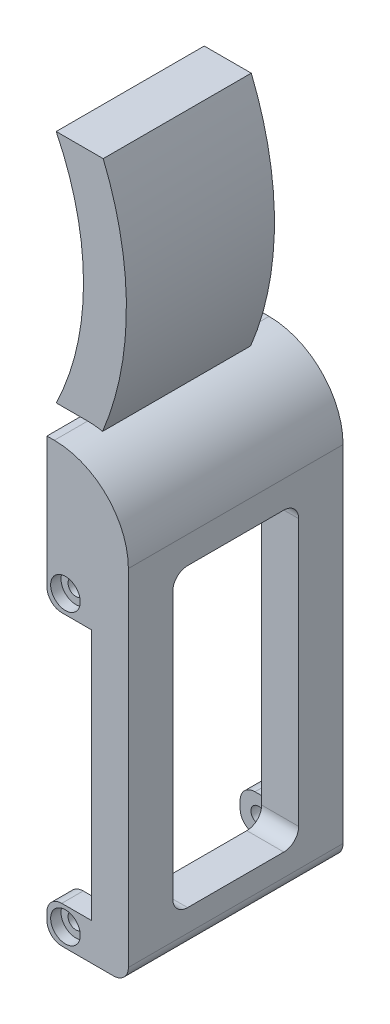
from build123d import *

# Parameters (mm, degrees)
BOSS_EXTRUDE5_DEPTH = 10
BOSS_EXTRUDE6_DEPTH = 14.5
BOSS_EXTRUDE7_REACH = 63.425
SKETCH28_W          = 11
SKETCH28_H          = 29
SKETCH37_W          = 23.2
SKETCH37_H          = 14.666666667
CUT_EXTRUDE10_DEPTH = 6
SKETCH38_W          = 23.2
SKETCH38_H          = 5
CUT_EXTRUDE11_DEPTH = 6
SKETCH39_R          = 1.05
CUT_EXTRUDE12_DEPTH = 81.736980805
SKETCH40_R          = 2
CUT_EXTRUDE13_DEPTH = 1.4
SKETCH41_R          = 2
CUT_EXTRUDE14_DEPTH = 1.4
SKETCH42_W          = 17
SKETCH42_H          = 40
CUT_EXTRUDE15_DEPTH = 77.175521458
FILLET2_R           = 2
CUT_EXTRUDE16_DEPTH = 80.232001549
BOSS_EXTRUDE8_DEPTH = 10
FILLET3_R           = 10


with BuildPart() as part:
    # Sketch25 → Boss-Extrude5 (new, symmetric)
    with BuildSketch(Plane.XY):
        with BuildLine():
            Line((0, 15.875), (6.35, 15.875))
            ThreePointArc((6.35, 15.875), (9.840958299, 0), (6.35, -15.875))
            Line((6.35, -15.875), (0, -15.875))
            ThreePointArc((0, -15.875), (4.187196601, 0), (0, 15.875))
        make_face()
    extrude(amount=BOSS_EXTRUDE5_DEPTH, both=True)


with BuildPart() as body_2:
    # Sketch27 → Boss-Extrude6 (new, symmetric)
    with BuildSketch(Plane.XY):
        Polygon((0, -30.541666667), (11, -30.541666667), (11, -74.541666667), (0, -74.541666667), (0, -69.541666667), (6, -69.541666667), (6, -35.541666667), (0, -35.541666667), align=None)
    extrude(amount=BOSS_EXTRUDE6_DEPTH, both=True)

    # Sketch28 → Boss-Extrude7 (add, up to next)
    with BuildSketch(Plane.XZ.offset(15.875), mode=Mode.PRIVATE) as boss_extrude7_sk1:
        with Locations((5.5, 0)):
            Rectangle(SKETCH28_W, SKETCH28_H)
    boss_extrude7_tool1 = extrude(boss_extrude7_sk1.sketch, amount=BOSS_EXTRUDE7_REACH, mode=Mode.PRIVATE) - body_2.part

    add(part.part)  # Boss-Extrude7 merges part
    add(boss_extrude7_tool1.solids().sort_by_distance((5.5, -15.875, 0))[0])

    # Sketch37 → Cut-Extrude10 (cut)
    with BuildSketch(Plane.ZY):
        with Locations((0, -28.208333334)):
            Rectangle(SKETCH37_W, SKETCH37_H)
    extrude(amount=-CUT_EXTRUDE10_DEPTH, mode=Mode.SUBTRACT)

    # Sketch38 → Cut-Extrude11 (cut)
    with BuildSketch(Plane.ZY):
        with Locations((0, -72.041666667)):
            Rectangle(SKETCH38_W, SKETCH38_H)
    extrude(amount=-CUT_EXTRUDE11_DEPTH, mode=Mode.SUBTRACT)

    # Sketch39 → Cut-Extrude12 (cut, through all)
    with BuildSketch(Plane(origin=(0, 0, -14.5), x_dir=(-1, 0, 0), z_dir=(0, 0, -1))):
        with Locations((-2.5, -33.041666667)):
            Circle(SKETCH39_R)
        with Locations((-2.5, -72.041666667)):
            Circle(SKETCH39_R)
    extrude(amount=-CUT_EXTRUDE12_DEPTH, mode=Mode.SUBTRACT)

    # Sketch40 → Cut-Extrude13 (cut)
    with BuildSketch(Plane(origin=(0, 0, -14.5), x_dir=(-1, 0, 0), z_dir=(0, 0, -1))):
        with Locations((-2.5, -33.041666667)):
            Circle(SKETCH40_R)
        with Locations((-2.5, -72.041666667)):
            Circle(SKETCH40_R)
    extrude(amount=-CUT_EXTRUDE13_DEPTH, mode=Mode.SUBTRACT)

    # Sketch41 → Cut-Extrude14 (cut)
    with BuildSketch(Plane.XY.offset(14.5)):
        with Locations(Location((2.5, -33.041666667, 0), (0, 0, 180))):
            Circle(SKETCH41_R)
        with Locations(Location((2.5, -72.041666667, 0), (0, 0, 180))):
            Circle(SKETCH41_R)
    extrude(amount=-CUT_EXTRUDE14_DEPTH, mode=Mode.SUBTRACT)

    # Sketch42 → Cut-Extrude15 (cut, through all)
    with BuildSketch(Plane.ZY.offset(-6)):
        with Locations((0, -49.541666667)):
            Rectangle(SKETCH42_W, SKETCH42_H)
    extrude(amount=-CUT_EXTRUDE15_DEPTH, mode=Mode.SUBTRACT)

    # Fillet2
    fillet2_edges = [body_2.edges().sort_by_distance(p)[0] for p in [
        (8.5, -69.541666667, -8.5),
        (8.5, -29.541666667, -8.5),
        (8.5, -29.541666667, 8.5),
        (8.5, -69.541666667, 8.5),
        (0, -35.541666667, 13.05),
        (0, -69.541666667, 13.05),
        (0, -74.541666667, 13.05),
        (11, -74.541666667, 0),
        (0, -35.541666667, -13.05),
        (0, -74.541666667, -13.05),
        (0, -69.541666667, -13.05),
    ]]
    fillet(fillet2_edges, radius=FILLET2_R)

    # Sketch44 → Cut-Extrude16 (cut, through all)
    with BuildSketch(Plane.XY.offset(10)):
        with BuildLine():
            Line((6.35, -15.875), (0, -15.875))
            ThreePointArc((0, -15.875), (4.187196601, 0), (0, 15.875))
            Line((0, 15.875), (6.35, 15.875))
            ThreePointArc((6.35, 15.875), (9.840958299, 0), (6.35, -15.875))
        make_face()
    extrude(amount=-CUT_EXTRUDE16_DEPTH, mode=Mode.SUBTRACT)

    # Sketch43 → Boss-Extrude8 (add, symmetric)
    with BuildSketch(Plane.XY):
        with BuildLine():
            Line((-3.25, 15.875), (3.1, 15.875))
            ThreePointArc((3.1, 15.875), (6.232422098, 0), (3.1, -15.875))
            Line((3.1, -15.875), (-3.25, -15.875))
            ThreePointArc((-3.25, -15.875), (0.439252949, 0), (-3.25, 15.875))
        make_face()
    extrude(amount=BOSS_EXTRUDE8_DEPTH, both=True)

    # Fillet3
    # the kernel refuses this fillet: 10 mm, written as the material it takes off along each edge
    with BuildSketch(Plane(origin=(11, -15.875, 39.5), x_dir=(-1, 0, 0), z_dir=(0, 0, -1))) as fillet3_piece_1_section:
        with BuildLine():
            CenterArc((FILLET3_R, -FILLET3_R), FILLET3_R, 90, 90)
            Line((0, -FILLET3_R), (0, 0))
            Line((0, 0), (FILLET3_R, 0))
        make_face()
    fillet3_piece_1 = extrude(amount=79, mode=Mode.PRIVATE)
    fillet3_piece_1 = split(fillet3_piece_1, bisect_by=Plane(origin=(2.190951885, -15.815672455, 10), z_dir=(0, 0, 1)), keep=Keep.TOP, mode=Mode.PRIVATE)
    fillet3_piece_1 = fillet3_piece_1 & Plane(origin=(-35.560747051, 0, 24.75), x_dir=(0.925049424055658, 0.3798467625955178, 0), z_dir=(0, 0, 1)) * Cylinder(41.793169149, 198, mode=Mode.PRIVATE)
    add(fillet3_piece_1, mode=Mode.SUBTRACT)
    with BuildSketch(Plane(origin=(11, -15.875, 39.5), x_dir=(-1, 0, 0), z_dir=(0, 0, -1))) as fillet3_piece_2_section:
        with BuildLine():
            CenterArc((FILLET3_R, -FILLET3_R), FILLET3_R, 90, 90)
            Line((0, -FILLET3_R), (0, 0))
            Line((0, 0), (FILLET3_R, 0))
        make_face()
    fillet3_piece_2 = extrude(amount=79, mode=Mode.PRIVATE)
    fillet3_piece_2 = split(fillet3_piece_2, bisect_by=Plane(origin=(8.886802667, -18.192463431, 10), z_dir=(0, 0, 1)), keep=Keep.TOP, mode=Mode.PRIVATE)
    fillet3_piece_2 = fillet3_piece_2 - Plane(origin=(-35.560747051, 0, 24.75), x_dir=(0.925049424055658, 0.3798467625955178, 0), z_dir=(0, 0, 1)) * Cylinder(41.793169149, 198, mode=Mode.PRIVATE)
    add(fillet3_piece_2, mode=Mode.SUBTRACT)
    with BuildSketch(Plane(origin=(11, -15.875, 39.5), x_dir=(-1, 0, 0), z_dir=(0, 0, -1))) as fillet3_piece_3_section:
        with BuildLine():
            CenterArc((FILLET3_R, -FILLET3_R), FILLET3_R, 90, 90)
            Line((0, -FILLET3_R), (0, 0))
            Line((0, 0), (FILLET3_R, 0))
        make_face()
    fillet3_piece_3 = extrude(amount=79, mode=Mode.PRIVATE)
    fillet3_piece_3 = split(fillet3_piece_3, bisect_by=Plane(origin=(8.886802667, -18.192463431, 10), z_dir=(0, 0, -1)), keep=Keep.TOP, mode=Mode.PRIVATE)
    fillet3_piece_3 = fillet3_piece_3 - Plane(origin=(-35.560747051, 0, 0), x_dir=(0.925049424055658, 0.3798467625955178, 0), z_dir=(0, 0, 1)) * Cylinder(41.793169149, 198, mode=Mode.PRIVATE)
    fillet3_piece_3 = split(fillet3_piece_3, bisect_by=Plane(origin=(8.886802667, -18.192463431, -10), z_dir=(0, 0, 1)), keep=Keep.TOP, mode=Mode.PRIVATE)
    add(fillet3_piece_3, mode=Mode.SUBTRACT)
    with BuildSketch(Plane(origin=(11, -15.875, 39.5), x_dir=(-1, 0, 0), z_dir=(0, 0, -1))) as fillet3_piece_4_section:
        with BuildLine():
            CenterArc((FILLET3_R, -FILLET3_R), FILLET3_R, 90, 90)
            Line((0, -FILLET3_R), (0, 0))
            Line((0, 0), (FILLET3_R, 0))
        make_face()
    fillet3_piece_4 = extrude(amount=79, mode=Mode.PRIVATE)
    fillet3_piece_4 = fillet3_piece_4 & Plane(origin=(-35.560747051, 0, -24.75), x_dir=(0.925049424055658, 0.3798467625955178, 0), z_dir=(0, 0, 1)) * Cylinder(41.793169149, 198, mode=Mode.PRIVATE)
    fillet3_piece_4 = split(fillet3_piece_4, bisect_by=Plane(origin=(2.190951885, -15.815672455, -10), z_dir=(0, 0, -1)), keep=Keep.TOP, mode=Mode.PRIVATE)
    add(fillet3_piece_4, mode=Mode.SUBTRACT)
    with BuildSketch(Plane(origin=(11, -15.875, 39.5), x_dir=(-1, 0, 0), z_dir=(0, 0, -1))) as fillet3_piece_5_section:
        with BuildLine():
            CenterArc((FILLET3_R, -FILLET3_R), FILLET3_R, 90, 90)
            Line((0, -FILLET3_R), (0, 0))
            Line((0, 0), (FILLET3_R, 0))
        make_face()
    fillet3_piece_5 = extrude(amount=79, mode=Mode.PRIVATE)
    fillet3_piece_5 = fillet3_piece_5 - Plane(origin=(-35.560747051, 0, -24.75), x_dir=(0.925049424055658, 0.3798467625955178, 0), z_dir=(0, 0, 1)) * Cylinder(41.793169149, 198, mode=Mode.PRIVATE)
    fillet3_piece_5 = split(fillet3_piece_5, bisect_by=Plane(origin=(8.886802667, -18.192463431, -10), z_dir=(0, 0, -1)), keep=Keep.TOP, mode=Mode.PRIVATE)
    add(fillet3_piece_5, mode=Mode.SUBTRACT)


solid = body_2.part
